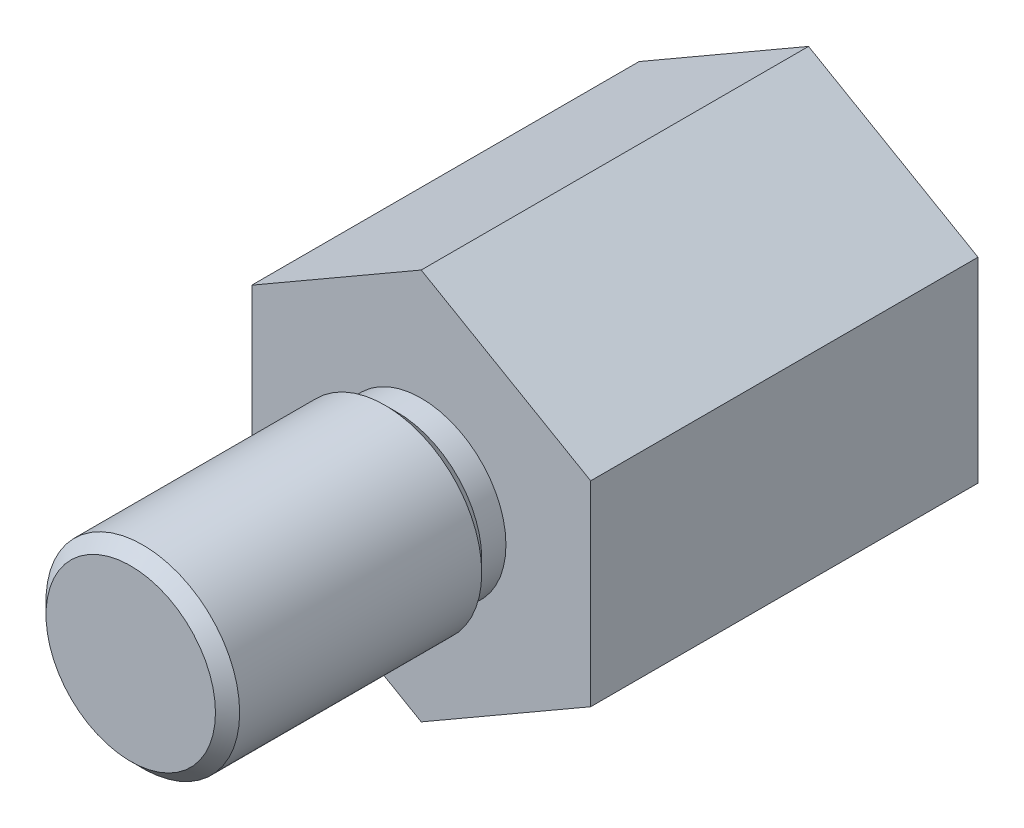
from build123d import *

# Parameters (mm, degrees)
EXTRUDE_1_DEPTH             = 8
SKETCH_2_R                  = 2
EXTRUDE_2_DEPTH             = 6
SKETCH_3_R                  = 2
SKETCH_3_R_2                = 1.75
CUT_EXTRUDE_3_DEPTH         = 0.5
CHAMFER_1_SIZE              = 0.25
HOLE_WIZARD_M41_D           = 3.3
HOLE_WIZARD_M41_DEPTH       = 6
HOLE_WIZARD_M41_CSINK_D     = 4
HOLE_WIZARD_M41_CSINK_ANGLE = 90
HOLE_WIZARD_M41_TIP         = 0.991420021


with BuildPart() as part:
    # Эскиз1 → Вытянуть1 (new body)
    with BuildSketch(Plane.XY):
        Polygon((0, 4.041451884), (-3.5, 2.020725942), (-3.5, -2.020725942), (0, -4.041451884), (3.5, -2.020725942), (3.5, 2.020725942), align=None)
    extrude(amount=EXTRUDE_1_DEPTH)

    # Эскиз2 → Вытянуть2 (add)
    with BuildSketch(Plane.XY.offset(8)):
        Circle(SKETCH_2_R)
    extrude(amount=EXTRUDE_2_DEPTH)

    # Эскиз3 → Вырез-Вытянуть3 (cut)
    with BuildSketch(Plane.XY.offset(8)):
        Circle(SKETCH_3_R)
        Circle(SKETCH_3_R_2, mode=Mode.SUBTRACT)
    extrude(amount=CUT_EXTRUDE_3_DEPTH, mode=Mode.SUBTRACT)

    # Фаска1
    chamfer_1_edges = [part.edges().sort_by_distance(p)[0] for p in [
        (-2, 0, 14),
        (-2, 0, 8.5),
    ]]
    chamfer(chamfer_1_edges, length=CHAMFER_1_SIZE - 0.0001)  # a hair under: the kernel refuses the full size

    # Отверстие с зазором M41
    with Locations(Plane(origin=(0, 0, 0), x_dir=(-1, 0, 0), z_dir=(0, 0, -1))):
        with Locations((0, 0)):
            CounterSinkHole(HOLE_WIZARD_M41_D / 2, HOLE_WIZARD_M41_CSINK_D / 2, depth=HOLE_WIZARD_M41_DEPTH, counter_sink_angle=HOLE_WIZARD_M41_CSINK_ANGLE)
            with Locations((0, 0, -(HOLE_WIZARD_M41_DEPTH + HOLE_WIZARD_M41_TIP / 2))):  # 118° drill point
                Cone(0, HOLE_WIZARD_M41_D / 2, HOLE_WIZARD_M41_TIP, mode=Mode.SUBTRACT)


solid = part.part
